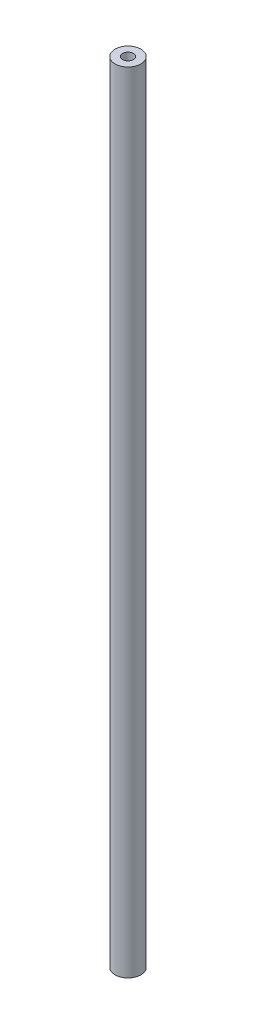
from build123d import *

# Parameters (mm, degrees)
SZKIC1_R                    = 5
DODANIE_WYCI_GNI_CIE1_DEPTH = 306
TAP_DRILL_FOR_M5_TAP2_D     = 4.2
TAP_DRILL_FOR_M5_TAP2_DEPTH = 30
TAP_DRILL_FOR_M5_TAP2_TIP   = 1.2618073
TAP_DRILL_FOR_M5_TAP1_D     = 4.2
TAP_DRILL_FOR_M5_TAP1_DEPTH = 30
TAP_DRILL_FOR_M5_TAP1_TIP   = 1.2618073


with BuildPart() as part:
    # Szkic1 → Dodanie-wyciągnięcie1 (new body)
    with BuildSketch(Plane(origin=(0, 0, 0), x_dir=(1, 0, 0), z_dir=(0, 1, 0))):
        Circle(SZKIC1_R)
    extrude(amount=DODANIE_WYCI_GNI_CIE1_DEPTH)

    # Tap Drill for M5 Tap2
    with Locations(Plane(origin=(0, 0, 0), x_dir=(-1, 0, 0), z_dir=(0, -1, 0))):
        with Locations((0, 0)):
            Hole(TAP_DRILL_FOR_M5_TAP2_D / 2, depth=TAP_DRILL_FOR_M5_TAP2_DEPTH)
            with Locations((0, 0, -(TAP_DRILL_FOR_M5_TAP2_DEPTH + TAP_DRILL_FOR_M5_TAP2_TIP / 2))):  # 118° drill point
                Cone(0, TAP_DRILL_FOR_M5_TAP2_D / 2, TAP_DRILL_FOR_M5_TAP2_TIP, mode=Mode.SUBTRACT)

    # Tap Drill for M5 Tap1
    with Locations(Plane(origin=(0, 306, 0), x_dir=(1, 0, 0), z_dir=(0, 1, 0))):
        with Locations((0, 0)):
            Hole(TAP_DRILL_FOR_M5_TAP1_D / 2, depth=TAP_DRILL_FOR_M5_TAP1_DEPTH)
            with Locations((0, 0, -(TAP_DRILL_FOR_M5_TAP1_DEPTH + TAP_DRILL_FOR_M5_TAP1_TIP / 2))):  # 118° drill point
                Cone(0, TAP_DRILL_FOR_M5_TAP1_D / 2, TAP_DRILL_FOR_M5_TAP1_TIP, mode=Mode.SUBTRACT)


solid = part.part
